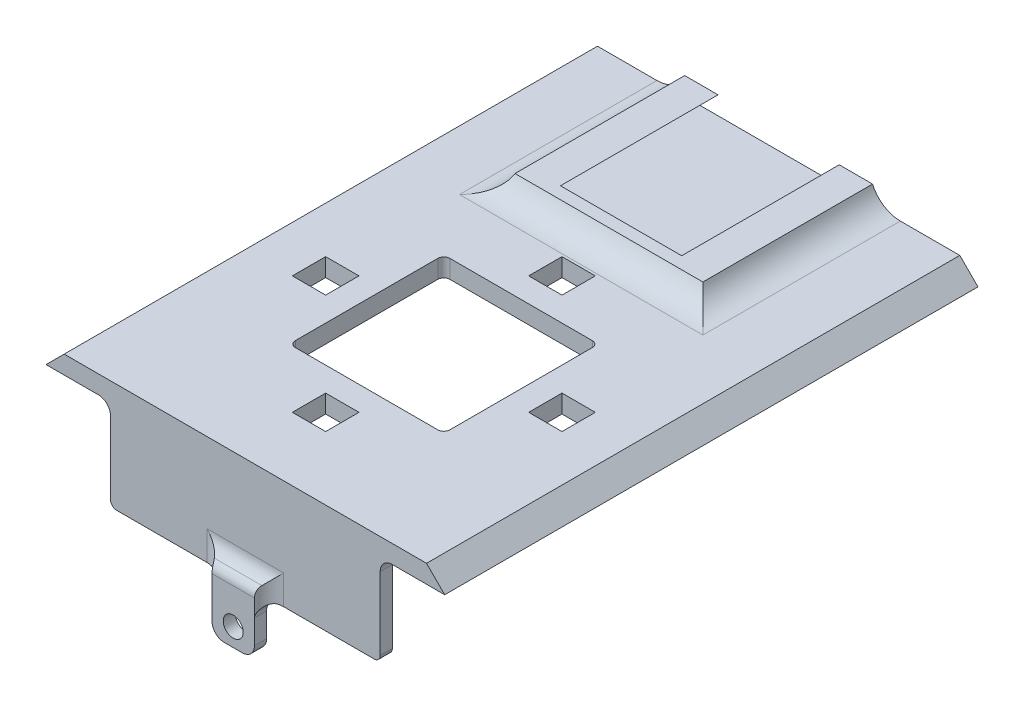
from build123d import *

# Parameters (mm, degrees)
BOSS_EXTRUDE1_DEPTH = 88
SKETCH2_W           = 44.5
SKETCH2_H           = 15
BOSS_EXTRUDE2_DEPTH = 2
SKETCH3_W           = 7
SKETCH3_H           = 10
SKETCH3_R           = 1.65
BOSS_EXTRUDE3_DEPTH = 2
FILLET1_R           = 3
FILLET2_R           = 2
FILLET3_R           = 2
FILLET4_R           = 2
FILLET5_R           = 0.5
FILLET6_R           = 1
FILLET7_R           = 2
SKETCH4_W           = 25.5
SKETCH4_H           = 25.5
SKETCH4_W_2         = 5.5
SKETCH4_H_2         = 5.5
CUT_EXTRUDE1_DEPTH  = 3
FILLET8_R           = 1
BOSS_EXTRUDE4_DEPTH = 28
BOSS_EXTRUDE5_REACH = 104.975
SKETCH7_W           = 2
SKETCH7_H           = 3
FILLET9_R           = 5


with BuildPart() as part:
    # Sketch1 → Boss-Extrude1 (new body)
    with BuildSketch(Plane.XY):
        Polygon((29.896446609, 3.25), (32.896446609, 0.25), (-32.896446609, 0.25), (-29.896446609, 3.25), align=None)
    extrude(amount=-BOSS_EXTRUDE1_DEPTH)

    # Sketch2 → Boss-Extrude2 (add)
    with BuildSketch(Plane.XY):
        with Locations((0, -7.25)):
            Rectangle(SKETCH2_W, SKETCH2_H)
    extrude(amount=-BOSS_EXTRUDE2_DEPTH)

    # Sketch3 → Boss-Extrude3 (add)
    with BuildSketch(Plane.XY):
        with Locations((0, -17.75)):
            Rectangle(SKETCH3_W, SKETCH3_H)
        with Locations((0, -19.75)):
            Circle(SKETCH3_R, mode=Mode.SUBTRACT)
    extrude(amount=BOSS_EXTRUDE3_DEPTH)

    # Fillet1
    # the kernel refuses this fillet: 3 mm, written as the material it adds along each edge
    with BuildSketch(Plane(origin=(3.5, -12.75, 0), x_dir=(1, 0, 0), z_dir=(0, -1, 0))) as fillet1_piece_1_section:
        with BuildLine():
            CenterArc((2.828427125, 3), FILLET1_R, 199.471220634, 70.528779366)
            Line((0, 2), (-0.056568542, 1.98))
            ThreePointArc((-0.056568542, 1.98), (-0.06, 1), (-0.06, 0))
            Line((-0.06, 0), (0, -0.06))
            Line((0, -0.06), (2.828427125, -0.06))
            Line((2.828427125, -0.06), (2.828427125, 0))
        make_face()
    fillet1_piece_1 = extrude(amount=2, mode=Mode.PRIVATE)
    fillet1_piece_1 = split(fillet1_piece_1, bisect_by=Plane(origin=(4.103392335, -13.75, 0), z_dir=(0, 0, 1)), keep=Keep.TOP, mode=Mode.PRIVATE)
    add(fillet1_piece_1)
    with BuildSketch(Plane(origin=(-3.5, -14.75, 0), x_dir=(-1, 0, 0), z_dir=(0, 1, 0))) as fillet1_piece_2_section:
        with BuildLine():
            CenterArc((2.828427125, 3), FILLET1_R, 199.471220634, 70.528779366)
            Line((0, 2), (-0.056568542, 1.98))
            ThreePointArc((-0.056568542, 1.98), (-0.06, 1), (-0.06, 0))
            Line((-0.06, 0), (0, -0.06))
            Line((0, -0.06), (2.828427125, -0.06))
            Line((2.828427125, -0.06), (2.828427125, 0))
        make_face()
    fillet1_piece_2 = extrude(amount=2, mode=Mode.PRIVATE)
    fillet1_piece_2 = split(fillet1_piece_2, bisect_by=Plane(origin=(-4.103392335, -13.75, 0), z_dir=(0, 0, 1)), keep=Keep.TOP, mode=Mode.PRIVATE)
    add(fillet1_piece_2)
    with BuildSketch(Plane(origin=(-3.5, -12.75, 0), x_dir=(0, 1, 0), z_dir=(1, 0, 0))) as fillet1_piece_3:
        with BuildLine():
            CenterArc((2.828427125, 3), FILLET1_R, 199.471220634, 70.528779366)
            Line((0, 2), (-0.056568542, 1.98))
            ThreePointArc((-0.056568542, 1.98), (-0.06, 1), (-0.06, 0))
            Line((-0.06, 0), (0, -0.06))
            Line((0, -0.06), (2.828427125, -0.06))
            Line((2.828427125, -0.06), (2.828427125, 0))
        make_face()
    extrude(amount=7)
    with BuildSketch(Plane(origin=(-3.5, -12.75, 0), x_dir=(0, 1, 0), z_dir=(1, 0, 0))) as fillet1_piece_4a_section:
        with BuildLine():
            CenterArc((2.828427125, 3), FILLET1_R, 199.471220634, 70.528779366)
            Line((0, 2), (-0.056568542, 1.98))
            ThreePointArc((-0.056568542, 1.98), (-0.06, 1), (-0.06, 0))
            Line((-0.06, 0), (0, -0.06))
            Line((0, -0.06), (2.828427125, -0.06))
            Line((2.828427125, -0.06), (2.828427125, 0))
        make_face()
    fillet1_piece_4a = extrude(amount=14.071067812, mode=Mode.PRIVATE)
    fillet1_piece_4a = split(fillet1_piece_4a, bisect_by=Plane(origin=(3.5, -12.071681569, 0.51353179), z_dir=(1, 0, 0)), keep=Keep.TOP, mode=Mode.PRIVATE)
    with BuildSketch(Plane(origin=(3.5, -5.678932188, 0), x_dir=(1, 0, 0), z_dir=(0, -1, 0))) as fillet1_piece_4b_section:
        with BuildLine():
            CenterArc((2.828427125, 3), FILLET1_R, 199.471220634, 70.528779366)
            Line((0, 2), (-0.056568542, 1.98))
            ThreePointArc((-0.056568542, 1.98), (-0.06, 1), (-0.06, 0))
            Line((-0.06, 0), (0, -0.06))
            Line((0, -0.06), (2.828427125, -0.06))
            Line((2.828427125, -0.06), (2.828427125, 0))
        make_face()
    fillet1_piece_4b = extrude(amount=9.071067812, mode=Mode.PRIVATE)
    fillet1_piece_4b = split(fillet1_piece_4b, bisect_by=Plane(origin=(4.103392335, -12.75, 0.570016865), z_dir=(0, 1, 0)), keep=Keep.TOP, mode=Mode.PRIVATE)
    fillet1_piece_4b = split(fillet1_piece_4b, bisect_by=Plane(origin=(4.103392335, -9.214466094, 0), z_dir=(0, 0, 1)), keep=Keep.TOP, mode=Mode.PRIVATE)
    fillet1_piece_4 = fillet1_piece_4a & fillet1_piece_4b
    add(fillet1_piece_4)
    with BuildSketch(Plane(origin=(-3.5, -12.75, 0), x_dir=(0, 1, 0), z_dir=(1, 0, 0))) as fillet1_piece_5a_section:
        with BuildLine():
            CenterArc((2.828427125, 3), FILLET1_R, 199.471220634, 70.528779366)
            Line((0, 2), (-0.056568542, 1.98))
            ThreePointArc((-0.056568542, 1.98), (-0.06, 1), (-0.06, 0))
            Line((-0.06, 0), (0, -0.06))
            Line((0, -0.06), (2.828427125, -0.06))
            Line((2.828427125, -0.06), (2.828427125, 0))
        make_face()
    fillet1_piece_5a = extrude(amount=14.071067812, mode=Mode.PRIVATE)
    fillet1_piece_5a = split(fillet1_piece_5a, bisect_by=Plane(origin=(3.5, -12.071681569, 0.51353179), z_dir=(1, 0, 0)), keep=Keep.TOP, mode=Mode.PRIVATE)
    with BuildSketch(Plane(origin=(3.5, -5.678932188, 0), x_dir=(1, 0, 0), z_dir=(0, -1, 0))) as fillet1_piece_5b_section:
        with BuildLine():
            CenterArc((2.828427125, 3), FILLET1_R, 199.471220634, 70.528779366)
            Line((0, 2), (-0.056568542, 1.98))
            ThreePointArc((-0.056568542, 1.98), (-0.06, 1), (-0.06, 0))
            Line((-0.06, 0), (0, -0.06))
            Line((0, -0.06), (2.828427125, -0.06))
            Line((2.828427125, -0.06), (2.828427125, 0))
        make_face()
    fillet1_piece_5b = extrude(amount=9.071067812, mode=Mode.PRIVATE)
    fillet1_piece_5b = split(fillet1_piece_5b, bisect_by=Plane(origin=(4.899161086, -12.75, -0.029895047), z_dir=(0, 1, 0)), keep=Keep.TOP, mode=Mode.PRIVATE)
    fillet1_piece_5b = split(fillet1_piece_5b, bisect_by=Plane(origin=(4.899161086, -9.214466094, 0), z_dir=(0, 0, -1)), keep=Keep.TOP, mode=Mode.PRIVATE)
    fillet1_piece_5 = fillet1_piece_5a & fillet1_piece_5b
    add(fillet1_piece_5)
    with BuildSketch(Plane(origin=(-3.5, -12.75, 0), x_dir=(0, 1, 0), z_dir=(1, 0, 0))) as fillet1_piece_6a_section:
        with BuildLine():
            CenterArc((2.828427125, 3), FILLET1_R, 199.471220634, 70.528779366)
            Line((0, 2), (-0.056568542, 1.98))
            ThreePointArc((-0.056568542, 1.98), (-0.06, 1), (-0.06, 0))
            Line((-0.06, 0), (0, -0.06))
            Line((0, -0.06), (2.828427125, -0.06))
            Line((2.828427125, -0.06), (2.828427125, 0))
        make_face()
    fillet1_piece_6a = extrude(amount=14.071067812, mode=Mode.PRIVATE)
    fillet1_piece_6a = split(fillet1_piece_6a, bisect_by=Plane(origin=(3.5, -12.071681569, 0.51353179), z_dir=(1, 0, 0)), keep=Keep.TOP, mode=Mode.PRIVATE)
    with BuildSketch(Plane(origin=(3.5, -12.75, 0), x_dir=(1, 0, 0), z_dir=(0, -1, 0))) as fillet1_piece_6b_section:
        with BuildLine():
            CenterArc((2.828427125, 3), FILLET1_R, 199.471220634, 70.528779366)
            Line((0, 2), (-0.056568542, 1.98))
            ThreePointArc((-0.056568542, 1.98), (-0.06, 1), (-0.06, 0))
            Line((-0.06, 0), (0, -0.06))
            Line((0, -0.06), (2.828427125, -0.06))
            Line((2.828427125, -0.06), (2.828427125, 0))
        make_face()
    fillet1_piece_6b = extrude(amount=2, mode=Mode.PRIVATE)
    fillet1_piece_6b = split(fillet1_piece_6b, bisect_by=Plane(origin=(4.899161086, -13.75, 0), z_dir=(0, 0, -1)), keep=Keep.TOP, mode=Mode.PRIVATE)
    fillet1_piece_6 = fillet1_piece_6a & fillet1_piece_6b
    add(fillet1_piece_6)
    with BuildSketch(Plane(origin=(-3.5, -14.75, 0), x_dir=(-1, 0, 0), z_dir=(0, 1, 0))) as fillet1_piece_7a_section:
        with BuildLine():
            CenterArc((2.828427125, 3), FILLET1_R, 199.471220634, 70.528779366)
            Line((0, 2), (-0.056568542, 1.98))
            ThreePointArc((-0.056568542, 1.98), (-0.06, 1), (-0.06, 0))
            Line((-0.06, 0), (0, -0.06))
            Line((0, -0.06), (2.828427125, -0.06))
            Line((2.828427125, -0.06), (2.828427125, 0))
        make_face()
    fillet1_piece_7a = extrude(amount=9.071067812, mode=Mode.PRIVATE)
    fillet1_piece_7a = split(fillet1_piece_7a, bisect_by=Plane(origin=(-4.103392335, -12.75, 0.570016865), z_dir=(0, 1, 0)), keep=Keep.TOP, mode=Mode.PRIVATE)
    fillet1_piece_7a = split(fillet1_piece_7a, bisect_by=Plane(origin=(-4.103392335, -9.214466094, 0), z_dir=(0, 0, 1)), keep=Keep.TOP, mode=Mode.PRIVATE)
    with BuildSketch(Plane(origin=(-10.571067812, -12.75, 0), x_dir=(0, 1, 0), z_dir=(1, 0, 0))) as fillet1_piece_7b_section:
        with BuildLine():
            CenterArc((2.828427125, 3), FILLET1_R, 199.471220634, 70.528779366)
            Line((0, 2), (-0.056568542, 1.98))
            ThreePointArc((-0.056568542, 1.98), (-0.06, 1), (-0.06, 0))
            Line((-0.06, 0), (0, -0.06))
            Line((0, -0.06), (2.828427125, -0.06))
            Line((2.828427125, -0.06), (2.828427125, 0))
        make_face()
    fillet1_piece_7b = extrude(amount=14.071067812, mode=Mode.PRIVATE)
    fillet1_piece_7b = split(fillet1_piece_7b, bisect_by=Plane(origin=(-3.5, -12.071681569, 0.51353179), z_dir=(-1, 0, 0)), keep=Keep.TOP, mode=Mode.PRIVATE)
    fillet1_piece_7 = fillet1_piece_7a & fillet1_piece_7b
    add(fillet1_piece_7)
    with BuildSketch(Plane(origin=(-3.5, -14.75, 0), x_dir=(-1, 0, 0), z_dir=(0, 1, 0))) as fillet1_piece_8a_section:
        with BuildLine():
            CenterArc((2.828427125, 3), FILLET1_R, 199.471220634, 70.528779366)
            Line((0, 2), (-0.056568542, 1.98))
            ThreePointArc((-0.056568542, 1.98), (-0.06, 1), (-0.06, 0))
            Line((-0.06, 0), (0, -0.06))
            Line((0, -0.06), (2.828427125, -0.06))
            Line((2.828427125, -0.06), (2.828427125, 0))
        make_face()
    fillet1_piece_8a = extrude(amount=2, mode=Mode.PRIVATE)
    fillet1_piece_8a = split(fillet1_piece_8a, bisect_by=Plane(origin=(-4.899161086, -13.75, 0), z_dir=(0, 0, -1)), keep=Keep.TOP, mode=Mode.PRIVATE)
    with BuildSketch(Plane(origin=(-10.571067812, -12.75, 0), x_dir=(0, 1, 0), z_dir=(1, 0, 0))) as fillet1_piece_8b_section:
        with BuildLine():
            CenterArc((2.828427125, 3), FILLET1_R, 199.471220634, 70.528779366)
            Line((0, 2), (-0.056568542, 1.98))
            ThreePointArc((-0.056568542, 1.98), (-0.06, 1), (-0.06, 0))
            Line((-0.06, 0), (0, -0.06))
            Line((0, -0.06), (2.828427125, -0.06))
            Line((2.828427125, -0.06), (2.828427125, 0))
        make_face()
    fillet1_piece_8b = extrude(amount=14.071067812, mode=Mode.PRIVATE)
    fillet1_piece_8b = split(fillet1_piece_8b, bisect_by=Plane(origin=(-3.5, -12.071681569, 0.51353179), z_dir=(-1, 0, 0)), keep=Keep.TOP, mode=Mode.PRIVATE)
    fillet1_piece_8 = fillet1_piece_8a & fillet1_piece_8b
    add(fillet1_piece_8)
    with BuildSketch(Plane(origin=(-3.5, -14.75, 0), x_dir=(-1, 0, 0), z_dir=(0, 1, 0))) as fillet1_piece_9a_section:
        with BuildLine():
            CenterArc((2.828427125, 3), FILLET1_R, 199.471220634, 70.528779366)
            Line((0, 2), (-0.056568542, 1.98))
            ThreePointArc((-0.056568542, 1.98), (-0.06, 1), (-0.06, 0))
            Line((-0.06, 0), (0, -0.06))
            Line((0, -0.06), (2.828427125, -0.06))
            Line((2.828427125, -0.06), (2.828427125, 0))
        make_face()
    fillet1_piece_9a = extrude(amount=9.071067812, mode=Mode.PRIVATE)
    fillet1_piece_9a = split(fillet1_piece_9a, bisect_by=Plane(origin=(-4.899161086, -12.75, -0.029895047), z_dir=(0, 1, 0)), keep=Keep.TOP, mode=Mode.PRIVATE)
    fillet1_piece_9a = split(fillet1_piece_9a, bisect_by=Plane(origin=(-4.899161086, -9.214466094, 0), z_dir=(0, 0, -1)), keep=Keep.TOP, mode=Mode.PRIVATE)
    with BuildSketch(Plane(origin=(-10.571067812, -12.75, 0), x_dir=(0, 1, 0), z_dir=(1, 0, 0))) as fillet1_piece_9b_section:
        with BuildLine():
            CenterArc((2.828427125, 3), FILLET1_R, 199.471220634, 70.528779366)
            Line((0, 2), (-0.056568542, 1.98))
            ThreePointArc((-0.056568542, 1.98), (-0.06, 1), (-0.06, 0))
            Line((-0.06, 0), (0, -0.06))
            Line((0, -0.06), (2.828427125, -0.06))
            Line((2.828427125, -0.06), (2.828427125, 0))
        make_face()
    fillet1_piece_9b = extrude(amount=14.071067812, mode=Mode.PRIVATE)
    fillet1_piece_9b = split(fillet1_piece_9b, bisect_by=Plane(origin=(-3.5, -12.071681569, 0.51353179), z_dir=(-1, 0, 0)), keep=Keep.TOP, mode=Mode.PRIVATE)
    fillet1_piece_9 = fillet1_piece_9a & fillet1_piece_9b
    add(fillet1_piece_9)

    # Fillet2
    # the kernel refuses this fillet: 2 mm, written as the material it adds along each edge
    with BuildSketch(Plane(origin=(3.5, -14.75, 0), x_dir=(0, -1, 0), z_dir=(0, 0, 1))) as fillet2_piece_1_section:
        with BuildLine():
            CenterArc((FILLET2_R, FILLET2_R), FILLET2_R, 180, 90)
            Line((0, FILLET2_R), (0, 0))
            Line((0, 0), (FILLET2_R, 0))
        make_face()
    fillet2_piece_1 = extrude(amount=2, mode=Mode.PRIVATE)
    fillet2_piece_1 = fillet2_piece_1 - Plane(origin=(6.328427125, -15.280348572, 3), x_dir=(1, 0, 0), z_dir=(0, 1, 0)) * Cylinder(3, 12, mode=Mode.PRIVATE)
    add(fillet2_piece_1)
    with BuildSketch(Plane(origin=(-3.5, -14.75, 0), x_dir=(0, -1, 0), z_dir=(0, 0, 1))) as fillet2_piece_2_section:
        with BuildLine():
            CenterArc((FILLET2_R, -FILLET2_R), FILLET2_R, 90, 90)
            Line((0, -FILLET2_R), (0, 0))
            Line((0, 0), (FILLET2_R, 0))
        make_face()
    fillet2_piece_2 = extrude(amount=2, mode=Mode.PRIVATE)
    fillet2_piece_2 = fillet2_piece_2 - Plane(origin=(-6.328427125, -15.280348572, 3), x_dir=(-1, 0, 0), z_dir=(0, -1, 0)) * Cylinder(3, 12, mode=Mode.PRIVATE)
    add(fillet2_piece_2)

    # Fillet3
    fillet3_edges = [part.edges().sort_by_distance(p)[0] for p in [
        (-3.5, -22.75, 1),
        (3.5, -22.75, 1),
    ]]
    fillet(fillet3_edges, radius=FILLET3_R)

    # Fillet4
    fillet4_edges = [part.edges().sort_by_distance(p)[0] for p in [
        (0, -12.75, 2),
    ]]
    fillet(fillet4_edges, radius=FILLET4_R)

    # Fillet5
    fillet5_edges = [part.edges().sort_by_distance(p)[0] for p in [
        (0, -14.75, 0),
    ]]
    fillet(fillet5_edges, radius=FILLET5_R)

    # Fillet6
    fillet6_edges = [part.edges().sort_by_distance(p)[0] for p in [
        (22.25, -14.75, -1),
        (-22.25, -14.75, -1),
    ]]
    fillet(fillet6_edges, radius=FILLET6_R)

    # Fillet7
    fillet7_edges = [part.edges().sort_by_distance(p)[0] for p in [
        (22.25, 0.25, -1),
        (0, 0.25, -2),
        (-22.25, 0.25, -1),
    ]]
    fillet(fillet7_edges, radius=FILLET7_R)

    # Sketch4 → Cut-Extrude1 (cut)
    with BuildSketch(Plane(origin=(0, 3.25, 0), x_dir=(1, 0, 0), z_dir=(0, 1, 0))):
        with Locations((0, 32.75)):
            Rectangle(SKETCH4_W, SKETCH4_H)
        with Locations((0, 13.25)):
            Rectangle(SKETCH4_W_2, SKETCH4_H_2)
        with Locations((19.5, 32.75)):
            Rectangle(SKETCH4_W_2, SKETCH4_H_2)
        with Locations((-19.5, 32.75)):
            Rectangle(SKETCH4_W_2, SKETCH4_H_2)
        with Locations((0, 52.25)):
            Rectangle(SKETCH4_W_2, SKETCH4_H_2)
    extrude(amount=-CUT_EXTRUDE1_DEPTH, mode=Mode.SUBTRACT)

    # Fillet8
    fillet8_edges = [part.edges().sort_by_distance(p)[0] for p in [
        (12.75, 1.75, -20),
        (12.75, 1.75, -45.5),
        (-12.75, 1.75, -45.5),
        (-12.75, 1.75, -20),
    ]]
    fillet(fillet8_edges, radius=FILLET8_R)

    # Sketch6 → Boss-Extrude4 (add)
    with BuildSketch(Plane(origin=(0, 0, -88), x_dir=(-1, 0, 0), z_dir=(0, 0, -1))):
        Polygon((-13, 3.25), (-10, 6.25), (-15.5, 6.25), (-15.5, 3.25), align=None)
        Polygon((15.5, 6.25), (15.5, 3.25), (13, 3.25), (10, 6.25), align=None)
    extrude(amount=-BOSS_EXTRUDE4_DEPTH)

    # Boss-Extrude5: up to this plane
    boss_extrude5_end = Plane(origin=(13, 3.25, -60), z_dir=(-0.7071067811865439, -0.7071067811865512, 0))
    # Sketch7 → Boss-Extrude5 (add, up to the surface)
    with BuildSketch(Plane.ZY.offset(15.5), mode=Mode.PRIVATE) as boss_extrude5_sk1:
        with Locations((-61, 4.75)):
            Rectangle(SKETCH7_W, SKETCH7_H)
    boss_extrude5_tool1 = split(extrude(boss_extrude5_sk1.sketch, amount=-BOSS_EXTRUDE5_REACH, mode=Mode.PRIVATE), bisect_by=boss_extrude5_end, keep=Keep.BOTH, mode=Mode.PRIVATE)
    add(boss_extrude5_tool1.solids().sort_by_distance((-15.5, 4.75, -61))[0])

    # Fillet9
    # the kernel refuses this fillet: 5 mm, written as the material it adds along each edge
    with BuildSketch(Plane(origin=(15.5, 3.25, -60), x_dir=(0, 0, 1), z_dir=(-1, 0, 0))) as fillet9_piece_1:
        with BuildLine():
            CenterArc((4.582575695, 5), FILLET9_R, 203.578178478, 66.421821522)
            Line((0, 3), (-0.091651514, 2.96))
            ThreePointArc((-0.091651514, 2.96), (-0.1, 1.5), (-0.1, 0))
            Line((-0.1, 0), (0, -0.1))
            Line((0, -0.1), (4.582575695, -0.1))
            Line((4.582575695, -0.1), (4.582575695, 0))
        make_face()
    extrude(amount=31)
    with BuildSketch(Plane(origin=(-15.5, 3.25, -60), x_dir=(-1, 0, 0), z_dir=(0, 0, -1)), Plane(origin=(15.5, 3.25, -88), x_dir=(1, 0, 0), z_dir=(0, 0, 1))) as fillet9_piece_2:
        with BuildLine():
            CenterArc((4.582575695, 5), FILLET9_R, 203.578178478, 66.421821522)
            Line((0, 3), (-0.091651514, 2.96))
            ThreePointArc((-0.091651514, 2.96), (-0.1, 1.5), (-0.1, 0))
            Line((-0.1, 0), (0, -0.1))
            Line((0, -0.1), (4.582575695, -0.1))
            Line((4.582575695, -0.1), (4.582575695, 0))
        make_face()
    extrude(amount=28)
    with BuildSketch(Plane(origin=(26.956439237, 3.25, -60), x_dir=(0, 0, 1), z_dir=(-1, 0, 0))) as fillet9_piece_3a_section:
        with BuildLine():
            CenterArc((4.582575695, 5), FILLET9_R, 203.578178478, 66.421821522)
            Line((0, 3), (-0.091651514, 2.96))
            ThreePointArc((-0.091651514, 2.96), (-0.1, 1.5), (-0.1, 0))
            Line((-0.1, 0), (0, -0.1))
            Line((0, -0.1), (4.582575695, -0.1))
            Line((4.582575695, -0.1), (4.582575695, 0))
        make_face()
    fillet9_piece_3a = extrude(amount=42.456439237, mode=Mode.PRIVATE)
    fillet9_piece_3a = split(fillet9_piece_3a, bisect_by=Plane(origin=(15.5, 4.025816439, -58.884062279), z_dir=(1, 0, 0)), keep=Keep.TOP, mode=Mode.PRIVATE)
    with BuildSketch(Plane(origin=(15.5, 3.25, -88), x_dir=(1, 0, 0), z_dir=(0, 0, 1))) as fillet9_piece_3b_section:
        with BuildLine():
            CenterArc((4.582575695, 5), FILLET9_R, 203.578178478, 66.421821522)
            Line((0, 3), (-0.091651514, 2.96))
            ThreePointArc((-0.091651514, 2.96), (-0.1, 1.5), (-0.1, 0))
            Line((-0.1, 0), (0, -0.1))
            Line((0, -0.1), (4.582575695, -0.1))
            Line((4.582575695, -0.1), (4.582575695, 0))
        make_face()
    fillet9_piece_3b = extrude(amount=39.456439237, mode=Mode.PRIVATE)
    fillet9_piece_3b = split(fillet9_piece_3b, bisect_by=Plane(origin=(16.615937721, 4.025816439, -60), z_dir=(0, 0, 1)), keep=Keep.TOP, mode=Mode.PRIVATE)
    fillet9_piece_3 = fillet9_piece_3a & fillet9_piece_3b
    add(fillet9_piece_3)
    with BuildSketch(Plane(origin=(-15.5, 3.25, -48.543560763), x_dir=(-1, 0, 0), z_dir=(0, 0, -1))) as fillet9_piece_4a_section:
        with BuildLine():
            CenterArc((4.582575695, 5), FILLET9_R, 203.578178478, 66.421821522)
            Line((0, 3), (-0.091651514, 2.96))
            ThreePointArc((-0.091651514, 2.96), (-0.1, 1.5), (-0.1, 0))
            Line((-0.1, 0), (0, -0.1))
            Line((0, -0.1), (4.582575695, -0.1))
            Line((4.582575695, -0.1), (4.582575695, 0))
        make_face()
    fillet9_piece_4a = extrude(amount=39.456439237, mode=Mode.PRIVATE)
    fillet9_piece_4a = split(fillet9_piece_4a, bisect_by=Plane(origin=(-16.615937721, 4.025816439, -60), z_dir=(0, 0, 1)), keep=Keep.TOP, mode=Mode.PRIVATE)
    with BuildSketch(Plane(origin=(15.5, 3.25, -60), x_dir=(0, 0, 1), z_dir=(-1, 0, 0))) as fillet9_piece_4b_section:
        with BuildLine():
            CenterArc((4.582575695, 5), FILLET9_R, 203.578178478, 66.421821522)
            Line((0, 3), (-0.091651514, 2.96))
            ThreePointArc((-0.091651514, 2.96), (-0.1, 1.5), (-0.1, 0))
            Line((-0.1, 0), (0, -0.1))
            Line((0, -0.1), (4.582575695, -0.1))
            Line((4.582575695, -0.1), (4.582575695, 0))
        make_face()
    fillet9_piece_4b = extrude(amount=42.456439237, mode=Mode.PRIVATE)
    fillet9_piece_4b = split(fillet9_piece_4b, bisect_by=Plane(origin=(-15.5, 4.025816439, -58.884062279), z_dir=(-1, 0, 0)), keep=Keep.TOP, mode=Mode.PRIVATE)
    fillet9_piece_4 = fillet9_piece_4a & fillet9_piece_4b
    add(fillet9_piece_4)


solid = part.part
